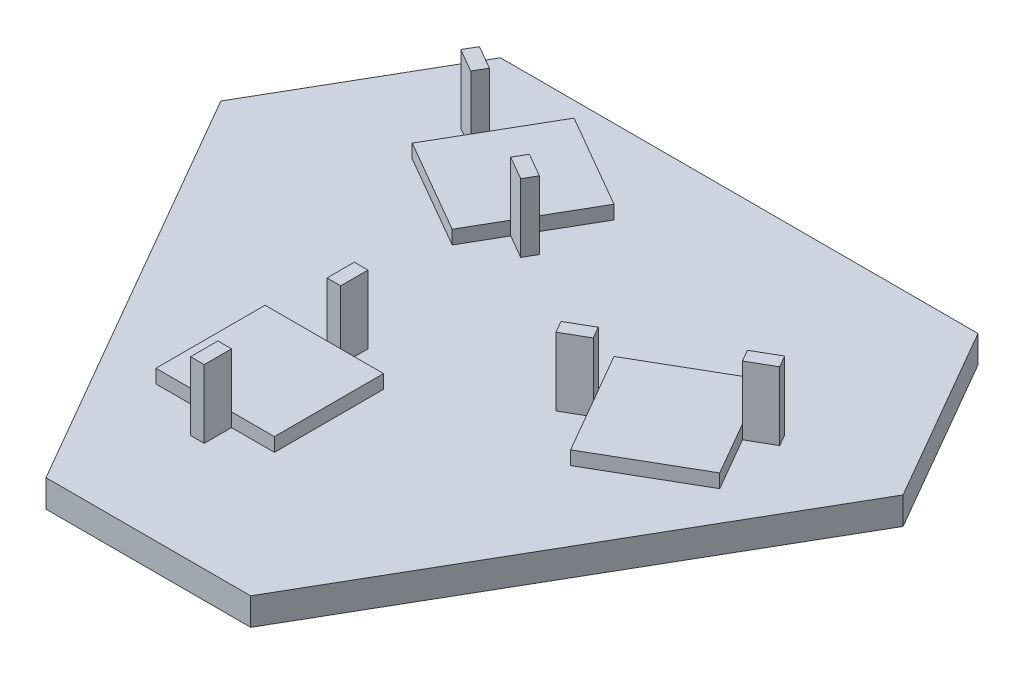
from build123d import *

# Parameters (mm, degrees)
BOSS_EXTRUDE1_DEPTH = 10
SKETCH2_W           = 43.4
SKETCH2_H           = 40
BOSS_EXTRUDE2_DEPTH = 5
SKETCH2_3_W         = 5
SKETCH2_3_H         = 10
BOSS_EXTRUDE3_DEPTH = 25


with BuildPart() as part:
    # Sketch1 → Boss-Extrude1 (new body)
    with BuildSketch(Plane(origin=(0, 0, 0), x_dir=(1, 0, 0), z_dir=(0, 1, 0))):
        Polygon((87.5, 216.506350946), (-87.5, 216.506350946), (-125, 151.554445662), (-37.5, 0), (37.5, 0), (125, 151.554445662), align=None)
    extrude(amount=BOSS_EXTRUDE1_DEPTH)

    # Sketch2 → Boss-Extrude2 (add)
    with BuildSketch(Plane(origin=(0, 10, 0), x_dir=(1, 0, 0), z_dir=(0, 1, 0))):
        Polygon((-71.55831553, 168.259103172), (-36.917299378, 148.259103172), (-15.217299378, 185.844605696), (-49.85831553, 205.844605696), align=None)
        with Locations((-25.3875, 69.872699064)):
            Rectangle(SKETCH2_W, SKETCH2_H)
        Polygon((67.727331913, 157.531367279), (33.086315761, 137.531367279), (54.786315761, 99.945864755), (89.427331913, 119.945864755), align=None)
    extrude(amount=BOSS_EXTRUDE2_DEPTH)

    # Sketch2<3> → Boss-Extrude3 (add)
    with BuildSketch(Plane(origin=(0, 10, 0), x_dir=(1, 0, 0), z_dir=(0, 1, 0))):
        Polygon((-26.567299378, 166.18582903), (-29.067299378, 161.855702011), (-20.40704534, 156.855702011), (-17.90704534, 161.18582903), align=None)
        Polygon((-72.368569567, 186.855702011), (-63.70831553, 181.855702011), (-61.20831553, 186.18582903), (-69.868569567, 191.18582903), align=None)
        with Locations((-21.8875, 94.872699064)):
            Rectangle(SKETCH2_3_W, SKETCH2_3_H)
        with Locations((-21.8875, 44.872699064)):
            Rectangle(SKETCH2_3_W, SKETCH2_3_H)
        Polygon((43.436315761, 119.60464142), (40.936315761, 123.934768439), (32.276061724, 118.934768439), (34.776061724, 114.60464142), align=None)
        Polygon((84.237585951, 148.934768439), (75.577331913, 143.934768439), (78.077331913, 139.60464142), (86.737585951, 144.60464142), align=None)
    extrude(amount=BOSS_EXTRUDE3_DEPTH)


solid = part.part
